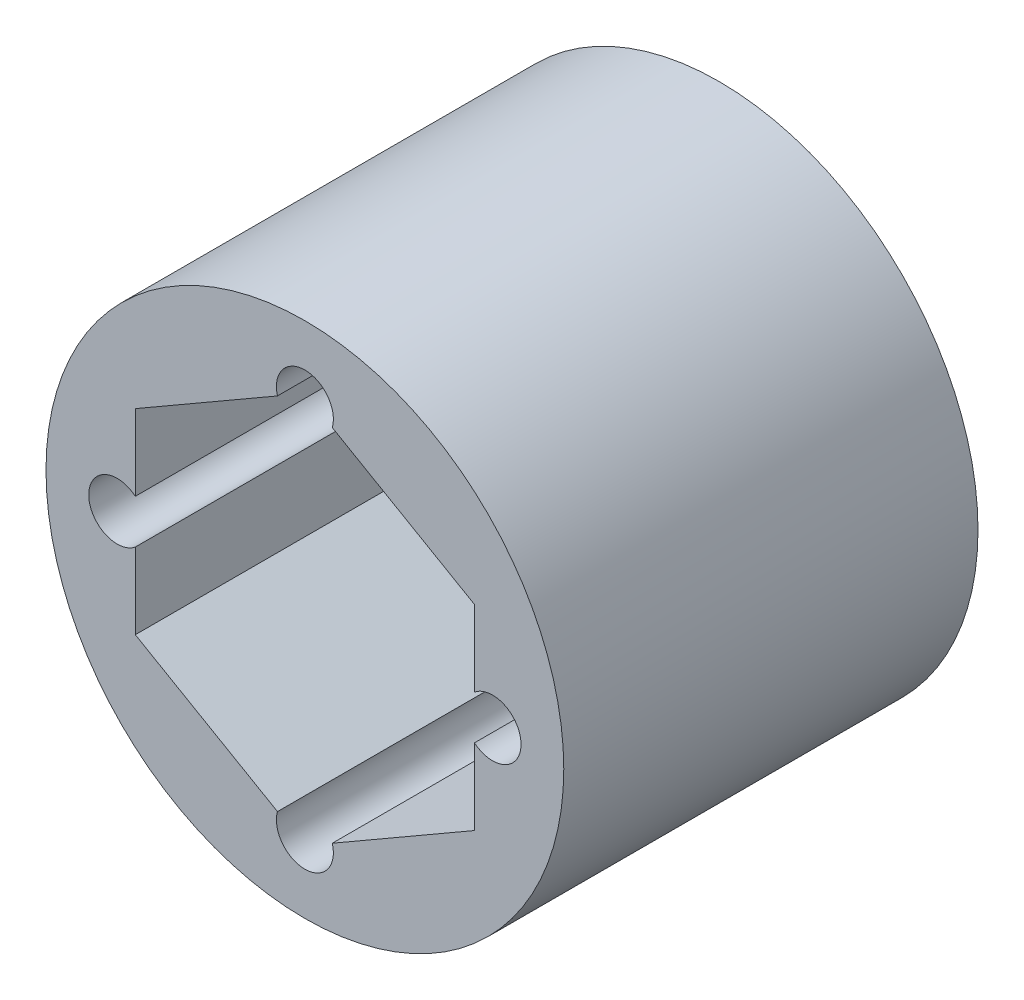
from build123d import *

# Parameters (mm, degrees)
SKETCH1_R           = 10
SKETCH1_R_2         = 1.1
SKETCH1_R_3         = 4.25
BOSS_EXTRUDE1_DEPTH = 16
CUT_EXTRUDE1_DEPTH  = 14


with BuildPart() as part:
    # Sketch1 → Boss-Extrude1 (new body)
    with BuildSketch(Plane.XY):
        Circle(SKETCH1_R)
        with Locations((0, 7.25)):
            Circle(SKETCH1_R_2, mode=Mode.SUBTRACT)
        Circle(SKETCH1_R_3, mode=Mode.SUBTRACT)
        with Locations((7.25, 0)):
            Circle(SKETCH1_R_2, mode=Mode.SUBTRACT)
        with Locations((0, -7.25)):
            Circle(SKETCH1_R_2, mode=Mode.SUBTRACT)
        with Locations((-7.25, 0)):
            Circle(SKETCH1_R_2, mode=Mode.SUBTRACT)
    extrude(amount=BOSS_EXTRUDE1_DEPTH)

    # Sketch2 → Cut-Extrude1 (cut)
    with BuildSketch(Plane.XY.offset(16)):
        Polygon((0, 7.563288526), (-6.55, 3.781644263), (-6.55, -3.781644263), (0, -7.563288526), (6.55, -3.781644263), (6.55, 3.781644263), align=None)
    extrude(amount=-CUT_EXTRUDE1_DEPTH, mode=Mode.SUBTRACT)


solid = part.part
